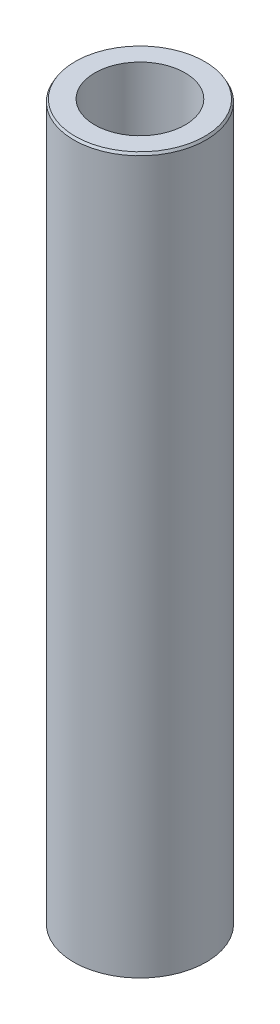
from build123d import *
from OCP.BRepFilletAPI import BRepFilletAPI_MakeChamfer

# Parameters (mm, degrees)
SKETCH1_R           = 10
BOSS_EXTRUDE1_DEPTH = 108.112324118
SKETCH2_R           = 6.821905879
CUT_EXTRUDE1_DEPTH  = 110.033364738
CHAMFER1_SIZE       = 0.370509777
CHAMFER1_SIZE2      = 0.213913919


with BuildPart() as part:
    # Sketch1 → Boss-Extrude1 (new body)
    with BuildSketch(Plane(origin=(0, 0, 0), x_dir=(1, 0, 0), z_dir=(0, 1, 0))):
        Circle(SKETCH1_R)
    extrude(amount=BOSS_EXTRUDE1_DEPTH)

    # Sketch2 → Cut-Extrude1 (cut, through all)
    with BuildSketch(Plane(origin=(0, 0, 0), x_dir=(1, 0, 0), z_dir=(0, 1, 0))):
        Circle(SKETCH2_R)
    extrude(amount=CUT_EXTRUDE1_DEPTH, mode=Mode.SUBTRACT)

    # Chamfer1: one chamfer whose edges measure the first distance from different faces: ONE call of the kernel's chamfer builder (chamfer() names one face for all edges)
    chamfer1_edges_1 = [part.edges().sort_by_distance(p)[0] for p in [
        (-10, 108.112324118, 0),
    ]]
    chamfer1_side_1 = [part.faces().sort_by_distance(p)[0] for p in [
        (-10, 54.056162059, 0),
    ]]
    chamfer1_edges_2 = [part.edges().sort_by_distance(p)[0] for p in [
        (-10, 0, 0),
    ]]
    chamfer1_side_2 = [part.faces().sort_by_distance(p)[0] for p in [
        (-9.717157288, 0, 0),
    ]]
    chamfer1 = BRepFilletAPI_MakeChamfer(part.part.solid().wrapped)
    for e in chamfer1_edges_1:
        chamfer1.Add(CHAMFER1_SIZE, CHAMFER1_SIZE2, e.wrapped, chamfer1_side_1[0].wrapped)  # the first distance lies on this face
    for e in chamfer1_edges_2:
        chamfer1.Add(CHAMFER1_SIZE, CHAMFER1_SIZE2, e.wrapped, chamfer1_side_2[0].wrapped)  # the first distance lies on this face
    add(Compound.cast(chamfer1.Shape()), mode=Mode.REPLACE)


solid = part.part
